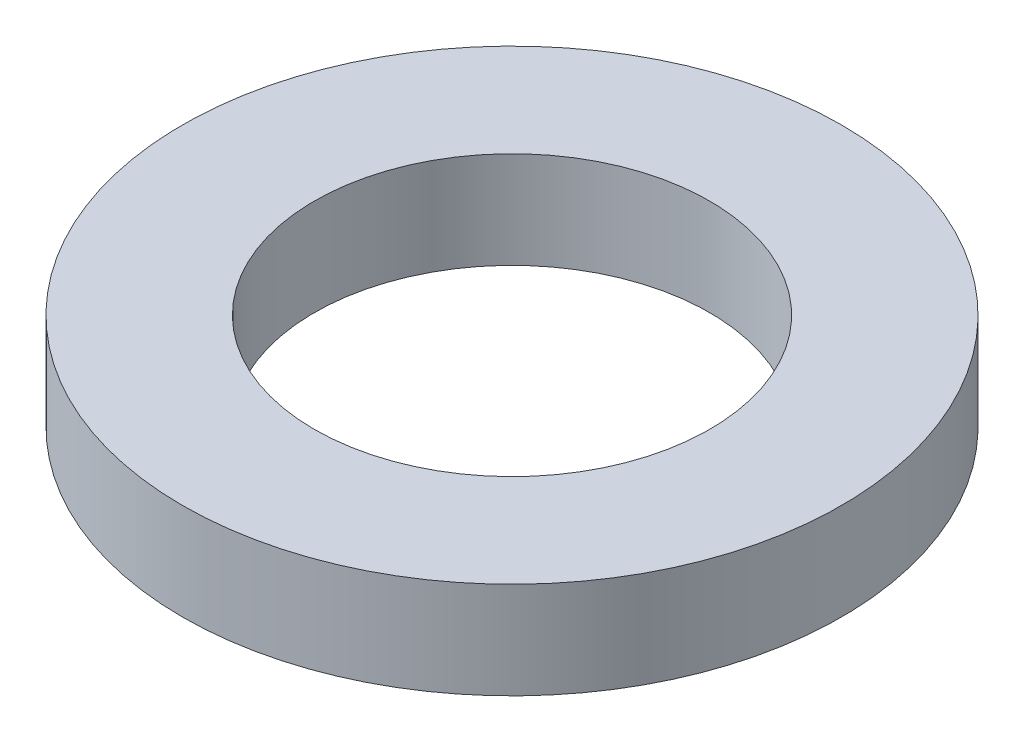
from build123d import *

# Parameters (mm, degrees)
SKETCH1_R           = 75
BOSS_EXTRUDE1_DEPTH = 22
SKETCH2_R           = 45
CUT_EXTRUDE1_DEPTH  = 109.323589305


with BuildPart() as part:
    # Sketch1 → Boss-Extrude1 (new body)
    with BuildSketch(Plane(origin=(0, 0, 0), x_dir=(1, 0, 0), z_dir=(0, 1, 0))):
        Circle(SKETCH1_R)
    extrude(amount=BOSS_EXTRUDE1_DEPTH)

    # Sketch2 → Cut-Extrude1 (cut, through all)
    with BuildSketch(Plane(origin=(0, 0, 0), x_dir=(1, 0, 0), z_dir=(0, 1, 0))):
        Circle(SKETCH2_R)
    extrude(amount=CUT_EXTRUDE1_DEPTH, mode=Mode.SUBTRACT)


solid = part.part
